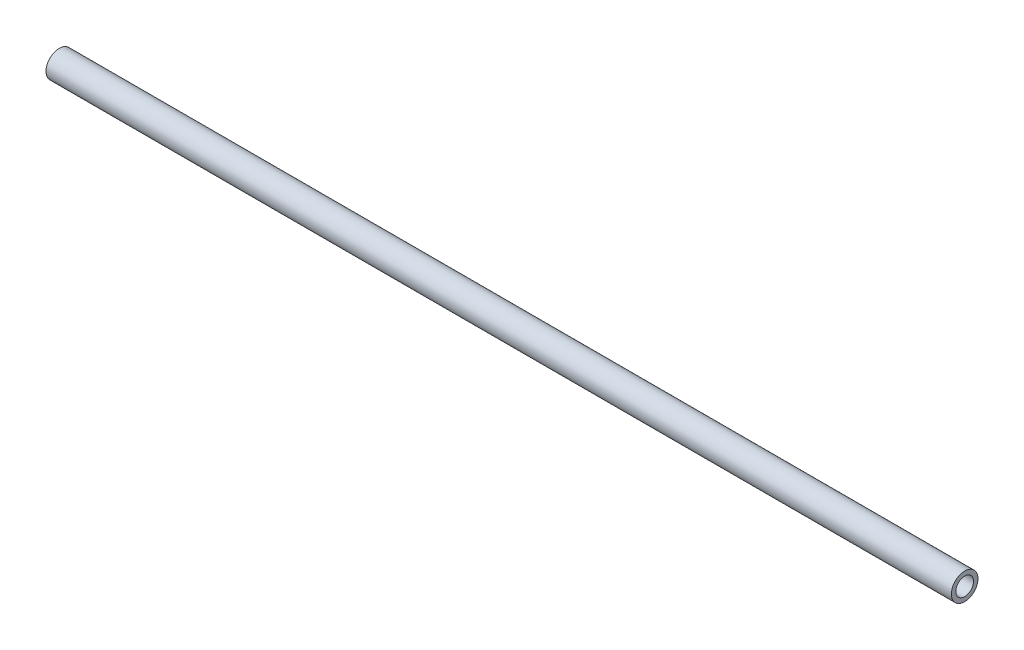
from build123d import *

# Parameters (mm, degrees)
SKETCH1_R           = 9.525
SKETCH1_R_2         = 6.35
BOSS_EXTRUDE1_DEPTH = 647.7


with BuildPart() as part:
    # Sketch1 → Boss-Extrude1 (new body)
    with BuildSketch(Plane(origin=(0, 0, 0), x_dir=(0, 0, -1), z_dir=(1, 0, 0))):
        Circle(SKETCH1_R)
        Circle(SKETCH1_R_2, mode=Mode.SUBTRACT)
    extrude(amount=BOSS_EXTRUDE1_DEPTH)


solid = part.part
